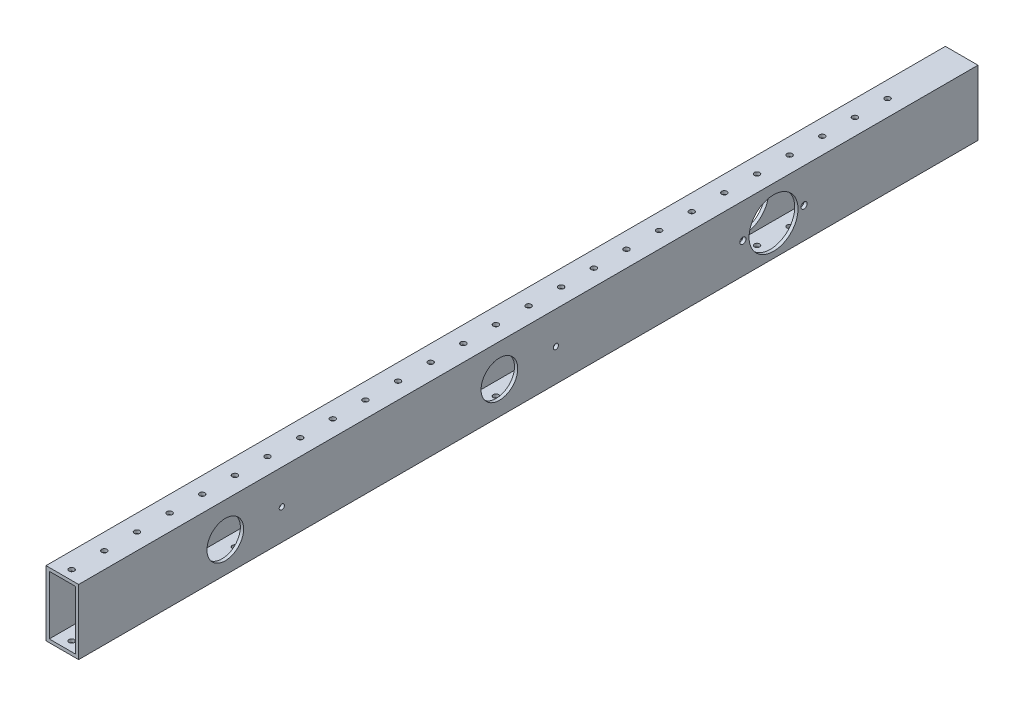
from build123d import *

# Parameters (mm, degrees)
CROQUIS1_W              = 25.4
CROQUIS1_H              = 50.7
CROQUIS1_W_2            = 20.32
CROQUIS1_H_2            = 45.62
SALIENTE_EXTRUIR1_DEPTH = 655
CROQUIS2_R              = 2.07
CORTAR_EXTRUIR1_DEPTH   = 658.082019234
CROQUIS3_R              = 14.275
CORTAR_EXTRUIR2_DEPTH   = 700
CROQUIS8_R              = 19.05
CROQUIS8_R_2            = 14.2748
CORTAR_EXTRUIR5_DEPTH   = 700
CROQUIS10_R             = 2.02
CORTAR_EXTRUIR7_DEPTH   = 656.982303496
CROQUIS12_R             = 2.02
CORTAR_EXTRUIR8_DEPTH   = 656.982303496
CROQUIS15_R             = 2.409528967
CROQUIS15_R_2           = 2.413
CORTAR_EXTRUIR10_DEPTH  = 656.982303496
CROQUIS16_W             = 25.4
CROQUIS16_H             = 50.7
CROQUIS16_W_2           = 20.32
CROQUIS16_H_2           = 45.62
SALIENTE_EXTRUIR2_DEPTH = 45


with BuildPart() as part:
    # Croquis1 → Saliente-Extruir1 (new body)
    with BuildSketch(Plane.XY):
        Rectangle(CROQUIS1_W, CROQUIS1_H)
        Rectangle(CROQUIS1_W_2, CROQUIS1_H_2, mode=Mode.SUBTRACT)
    extrude(amount=SALIENTE_EXTRUIR1_DEPTH)

    # Croquis2 → Cortar-Extruir1 (cut, through all)
    with BuildSketch(Plane(origin=(0, 25.35, 0), x_dir=(1, 0, 0), z_dir=(0, 1, 0))):
        with Locations((0, -12.7)):
            Circle(CROQUIS2_R)
        with Locations((0, -38.1)):
            Circle(CROQUIS2_R)
        with Locations((0, -63.5)):
            Circle(CROQUIS2_R)
        with Locations((0, -88.9)):
            Circle(CROQUIS2_R)
        with Locations((0, -114.3)):
            Circle(CROQUIS2_R)
        with Locations((0, -139.7)):
            Circle(CROQUIS2_R)
        with Locations((0, -165.1)):
            Circle(CROQUIS2_R)
        with Locations((0, -190.5)):
            Circle(CROQUIS2_R)
        with Locations((0, -215.9)):
            Circle(CROQUIS2_R)
        with Locations((0, -241.3)):
            Circle(CROQUIS2_R)
        with Locations((0, -266.7)):
            Circle(CROQUIS2_R)
        with Locations((0, -292.1)):
            Circle(CROQUIS2_R)
        with Locations((0, -317.5)):
            Circle(CROQUIS2_R)
        with Locations((0, -342.9)):
            Circle(CROQUIS2_R)
        with Locations((0, -368.3)):
            Circle(CROQUIS2_R)
        with Locations((0, -393.7)):
            Circle(CROQUIS2_R)
        with Locations((0, -419.1)):
            Circle(CROQUIS2_R)
        with Locations((0, -444.5)):
            Circle(CROQUIS2_R)
        with Locations((0, -469.9)):
            Circle(CROQUIS2_R)
        with Locations((0, -495.3)):
            Circle(CROQUIS2_R)
        with Locations((0, -520.7)):
            Circle(CROQUIS2_R)
        with Locations((0, -546.1)):
            Circle(CROQUIS2_R)
        with Locations((0, -571.5)):
            Circle(CROQUIS2_R)
        with Locations((0, -596.9)):
            Circle(CROQUIS2_R)
        with Locations((0, -622.3)):
            Circle(CROQUIS2_R)
        with Locations((0, -647.7)):
            Circle(CROQUIS2_R)
    extrude(amount=-CORTAR_EXTRUIR1_DEPTH, mode=Mode.SUBTRACT)

    # Croquis3 → Cortar-Extruir2 (cut)
    with BuildSketch(Plane.ZY.offset(12.7)):
        with Locations((327.5, 0)):
            Circle(CROQUIS3_R)
    extrude(amount=-CORTAR_EXTRUIR2_DEPTH, mode=Mode.SUBTRACT)

    # Croquis8 → Cortar-Extruir5 (cut)
    with BuildSketch(Plane.ZY.offset(12.7)):
        with Locations((114.145124111, -1.474)):
            Circle(CROQUIS8_R)
        with Locations((540.854875889, -1.474)):
            Circle(CROQUIS8_R_2)
    extrude(amount=-CORTAR_EXTRUIR5_DEPTH, mode=Mode.SUBTRACT)

    # Croquis10 → Cortar-Extruir7 (cut, through all)
    with BuildSketch(Plane(origin=(12.7, 0, 0), x_dir=(0, 0, -1), z_dir=(1, 0, 0))):
        with Locations((-496.854875889, -1.45)):
            Circle(CROQUIS10_R)
    extrude(amount=-CORTAR_EXTRUIR7_DEPTH, mode=Mode.SUBTRACT)

    # Croquis12 → Cortar-Extruir8 (cut, through all)
    with BuildSketch(Plane(origin=(12.7, 0, 0), x_dir=(0, 0, -1), z_dir=(1, 0, 0))):
        with Locations((-283.5, 0)):
            Circle(CROQUIS12_R)
    extrude(amount=-CORTAR_EXTRUIR8_DEPTH, mode=Mode.SUBTRACT)

    # Croquis15 → Cortar-Extruir10 (cut, through all)
    with BuildSketch(Plane.ZY.offset(12.7)):
        with Locations((137.957624111, -1.474)):
            Circle(CROQUIS15_R)
        with Locations((90.332624111, -1.474)):
            Circle(CROQUIS15_R_2)
    extrude(amount=-CORTAR_EXTRUIR10_DEPTH, mode=Mode.SUBTRACT)

    # Croquis16 → Saliente-Extruir2 (add)
    with BuildSketch(Plane(origin=(0, 0, 0), x_dir=(-1, 0, 0), z_dir=(0, 0, -1))):
        Rectangle(CROQUIS16_W, CROQUIS16_H)
        Rectangle(CROQUIS16_W_2, CROQUIS16_H_2, mode=Mode.SUBTRACT)
    extrude(amount=SALIENTE_EXTRUIR2_DEPTH)


solid = part.part
